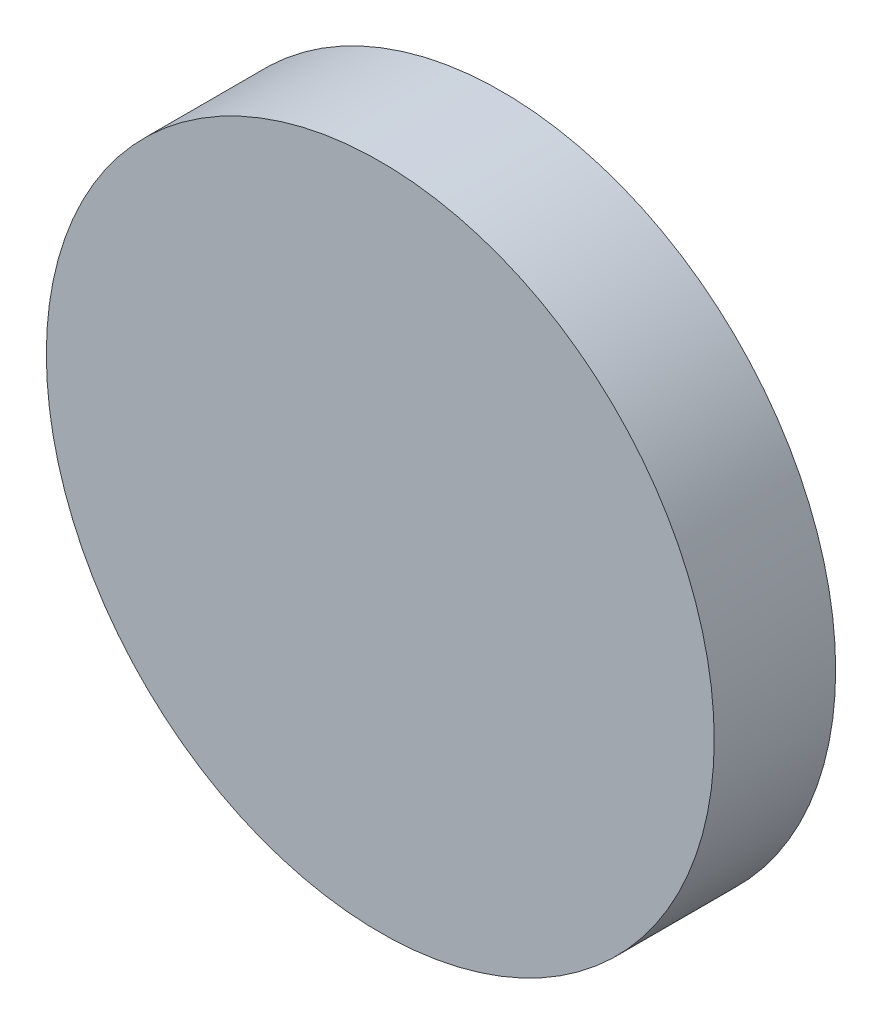
from build123d import *

# Parameters (mm, degrees)
SKETCH1_R           = 139.7
BOSS_EXTRUDE1_DEPTH = 25.4


with BuildPart() as part:
    # Sketch1 → Boss-Extrude1 (new, symmetric)
    with BuildSketch(Plane.XY):
        Circle(SKETCH1_R)
    extrude(amount=BOSS_EXTRUDE1_DEPTH, both=True)


solid = part.part
